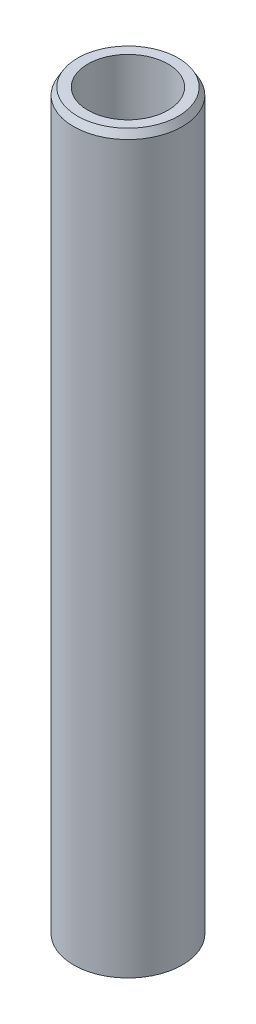
from build123d import *
from OCP.BRepFilletAPI import BRepFilletAPI_MakeChamfer

# Parameters (mm, degrees)
SKETCH1_R           = 37.5
BOSS_EXTRUDE1_DEPTH = 508.202251335
SKETCH2_R           = 27.646649734
CUT_EXTRUDE1_DEPTH  = 511.961865761
CHAMFER1_SIZE       = 4.821250826
CHAMFER1_SIZE2      = 2.783550462


with BuildPart() as part:
    # Sketch1 → Boss-Extrude1 (new body)
    with BuildSketch(Plane(origin=(0, 0, 0), x_dir=(1, 0, 0), z_dir=(0, 1, 0))):
        Circle(SKETCH1_R)
    extrude(amount=BOSS_EXTRUDE1_DEPTH)

    # Sketch2 → Cut-Extrude1 (cut, through all)
    with BuildSketch(Plane(origin=(0, 0, 0), x_dir=(1, 0, 0), z_dir=(0, 1, 0))):
        Circle(SKETCH2_R)
    extrude(amount=CUT_EXTRUDE1_DEPTH, mode=Mode.SUBTRACT)

    # Chamfer1: one chamfer whose edges measure the first distance from different faces: ONE call of the kernel's chamfer builder (chamfer() names one face for all edges)
    chamfer1_edges_1 = [part.edges().sort_by_distance(p)[0] for p in [
        (-37.5, 508.202251335, 0),
    ]]
    chamfer1_side_1 = [part.faces().sort_by_distance(p)[0] for p in [
        (-37.5, 254.101125668, 0),
    ]]
    chamfer1_edges_2 = [part.edges().sort_by_distance(p)[0] for p in [
        (-37.5, 0, 0),
    ]]
    chamfer1_side_2 = [part.faces().sort_by_distance(p)[0] for p in [
        (-36.439339828, 0, 0),
    ]]
    chamfer1 = BRepFilletAPI_MakeChamfer(part.part.solid().wrapped)
    for e in chamfer1_edges_1:
        chamfer1.Add(CHAMFER1_SIZE, CHAMFER1_SIZE2, e.wrapped, chamfer1_side_1[0].wrapped)  # the first distance lies on this face
    for e in chamfer1_edges_2:
        chamfer1.Add(CHAMFER1_SIZE, CHAMFER1_SIZE2, e.wrapped, chamfer1_side_2[0].wrapped)  # the first distance lies on this face
    add(Compound.cast(chamfer1.Shape()), mode=Mode.REPLACE)


solid = part.part
